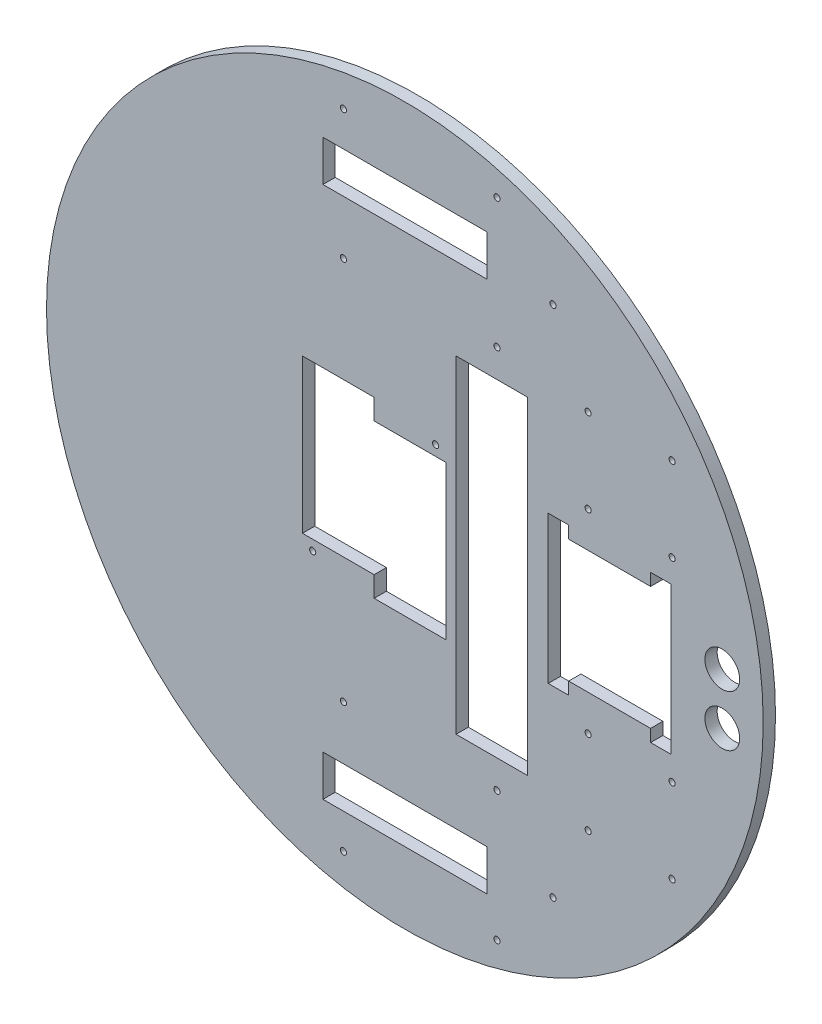
from build123d import *

# Parameters (mm, degrees)
SKETCH1_R           = 175
BOSS_EXTRUDE1_DEPTH = 6
SKETCH2_W           = 80
SKETCH2_H           = 20
SKETCH2_W_2         = 60
SKETCH2_H_2         = 60
CUT_EXTRUDE1_DEPTH  = 248.560093715
SKETCH3_W           = 10
SKETCH3_H           = 6
CUT_EXTRUDE2_DEPTH  = 248.560093715
SKETCH4_R           = 1.5
CUT_EXTRUDE3_DEPTH  = 248.560093715
SKETCH5_R           = 1.5
CUT_EXTRUDE4_DEPTH  = 248.560093715
SKETCH6_R           = 8.5
CUT_EXTRUDE5_DEPTH  = 248.560093715
CAVITY1_OUTLINE_R   = 1.5
CAVITY1_DEPTH       = 6
SKETCH7_W           = 35
SKETCH7_H           = 160
CUT_EXTRUDE6_DEPTH  = 248.560093715
SKETCH8_R           = 1.5
CUT_EXTRUDE7_DEPTH  = 10


# Read off the part's stored shape, not the designer's step: Cavity1
with BuildPart() as part:
    # Sketch1 → Boss-Extrude1 (new body)
    with BuildSketch(Plane.XY):
        Circle(SKETCH1_R)
    extrude(amount=BOSS_EXTRUDE1_DEPTH)

    # Sketch2 → Cut-Extrude1 (cut, through all)
    with BuildSketch(Plane(origin=(0, 0, 0), x_dir=(-1, 0, 0), z_dir=(0, 0, -1))):
        with Locations((0, 130)):
            Rectangle(SKETCH2_W, SKETCH2_H)
        with Locations((0, -130)):
            Rectangle(SKETCH2_W, SKETCH2_H)
        with Locations((-100, 0)):
            Rectangle(SKETCH2_W_2, SKETCH2_H_2)
    extrude(amount=-CUT_EXTRUDE1_DEPTH, mode=Mode.SUBTRACT)

    # Sketch3 → Cut-Extrude2 (cut, through all)
    with BuildSketch(Plane.XY.offset(6)):
        with Locations((75, 33)):
            Rectangle(SKETCH3_W, SKETCH3_H)
        with Locations((125, 33)):
            Rectangle(SKETCH3_W, SKETCH3_H)
        with Locations((75, -33)):
            Rectangle(SKETCH3_W, SKETCH3_H)
        with Locations((125, -33)):
            Rectangle(SKETCH3_W, SKETCH3_H)
    extrude(amount=-CUT_EXTRUDE2_DEPTH, mode=Mode.SUBTRACT)

    # Sketch4 → Cut-Extrude3 (cut, through all)
    with BuildSketch(Plane.XY.offset(6)):
        with Locations((-30, -157)):
            Circle(SKETCH4_R)
        with Locations((45, -157)):
            Circle(SKETCH4_R)
        with Locations(Location((-30, 157, 0), (0, 0, 180))):
            Circle(SKETCH4_R)
        with Locations(Location((45, 157, 0), (0, 0, 180))):
            Circle(SKETCH4_R)
        with Locations(Location((45, -93.75, 0), (0, 0, 180))):
            Circle(SKETCH4_R)
        with Locations(Location((-30, -93.75, 0), (0, 0, 180))):
            Circle(SKETCH4_R)
        with Locations((45, 93.75)):
            Circle(SKETCH4_R)
        with Locations((-30, 93.75)):
            Circle(SKETCH4_R)
    extrude(amount=-CUT_EXTRUDE3_DEPTH, mode=Mode.SUBTRACT)

    # Sketch5 → Cut-Extrude4 (cut, through all)
    with BuildSketch(Plane.XY.offset(6)):
        with Locations((89.5, 88.5)):
            Circle(SKETCH5_R)
        with Locations((130.5, 88.5)):
            Circle(SKETCH5_R)
        with Locations((130.5, 47.5)):
            Circle(SKETCH5_R)
        with Locations((89.5, 47.5)):
            Circle(SKETCH5_R)
        with Locations(Location((89.5, -88.5, 0), (0, 0, 180))):
            Circle(SKETCH5_R)
        with Locations(Location((130.5, -88.5, 0), (0, 0, 180))):
            Circle(SKETCH5_R)
        with Locations(Location((130.5, -47.5, 0), (0, 0, 180))):
            Circle(SKETCH5_R)
        with Locations(Location((89.5, -47.5, 0), (0, 0, 180))):
            Circle(SKETCH5_R)
    extrude(amount=-CUT_EXTRUDE4_DEPTH, mode=Mode.SUBTRACT)

    # Sketch6 → Cut-Extrude5 (cut, through all)
    with BuildSketch(Plane.XY.offset(6)):
        with Locations((155, 12.5)):
            Circle(SKETCH6_R)
        with Locations((155, -12.5)):
            Circle(SKETCH6_R)
    extrude(amount=-CUT_EXTRUDE5_DEPTH, mode=Mode.SUBTRACT)

    # Cavity1 outline → Cavity1 (cut)
    with BuildSketch(Plane.XY):
        with Locations((72.337603572, -125.375)):
            Circle(CAVITY1_OUTLINE_R)
        with Locations((72.337603572, 125.375)):
            Circle(CAVITY1_OUTLINE_R)
    extrude(amount=CAVITY1_DEPTH, mode=Mode.SUBTRACT)

    # Sketch7 → Cut-Extrude6 (cut, through all)
    with BuildSketch(Plane.XY.offset(6)):
        with Locations((42.5, 0)):
            Rectangle(SKETCH7_W, SKETCH7_H)
    extrude(amount=-CUT_EXTRUDE6_DEPTH, mode=Mode.SUBTRACT)

    # Sketch8 → Cut-Extrude7 (cut)
    with BuildSketch(Plane.XY.offset(6)):
        with Locations((15, 37.5)):
            Circle(SKETCH8_R)
        with Locations((-45, -37.5)):
            Circle(SKETCH8_R)
        Polygon((-15, 32.5), (20, 32.5), (20, -32.5), (20, -42.5), (-15, -42.5), (-15, -32.5), (-50, -32.5), (-50, 42.5), (-15, 42.5), align=None)
    extrude(amount=-CUT_EXTRUDE7_DEPTH, mode=Mode.SUBTRACT)


solid = part.part
